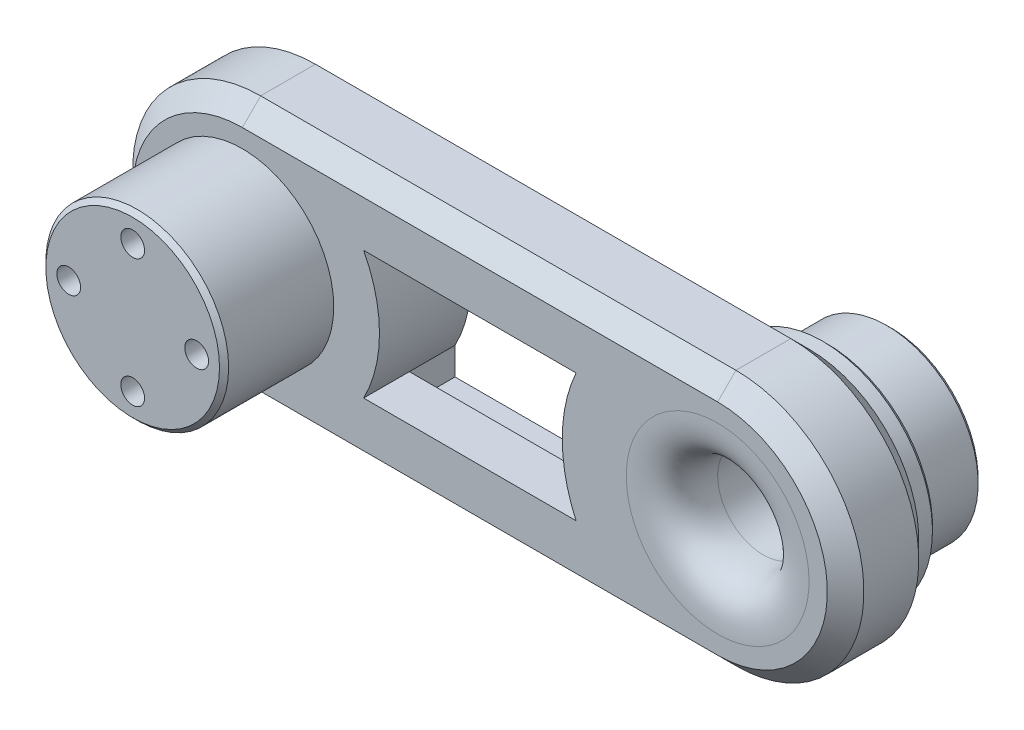
from build123d import *

# Parameters (mm, degrees)
EXTRUDE_1_DEPTH     = 10
SKETCH_2_R          = 10
EXTRUDE_2_DEPTH     = 12
SKETCH_3_R          = 10
EXTRUDE_3_DEPTH     = 9
SKETCH_4_R          = 12
SKETCH_4_R_2        = 10
EXTRUDE_4_DEPTH     = 2
CHAMFER_1_SIZE      = 0.5
CHAMFER_2_SIZE      = 2
SKETCH_5_R          = 2
CUT_EXTRUDE_1_DEPTH = 6
SKETCH_6_R          = 1.3
CUT_EXTRUDE_2_DEPTH = 6
CUT_EXTRUDE_3_DEPTH = 10
SKETCH_8_W          = 23.241567454
SKETCH_8_H          = 3
CUT_EXTRUDE_4_DEPTH = 5
SKETCH_9_R          = 5
CUT_EXTRUDE_5_DEPTH = 10
SKETCH_10_R         = 5
CUT_EXTRUDE_6_DEPTH = 10
FILLET_1_SIZE       = 5


# Some blends are built 0.0001 mm under size
with BuildPart() as part:
    # 草图1 → 凸台-拉伸1 (new body)
    with BuildSketch(Plane.XY):
        with BuildLine():
            Line((52, 14), (0, 14))
            ThreePointArc((0, 14), (-14, 0), (0, -14))
            Line((0, -14), (52, -14))
            ThreePointArc((52, -14), (66, 0), (52, 14))
        make_face()
    extrude(amount=EXTRUDE_1_DEPTH)

    # 草图2 → 凸台-拉伸2 (add)
    with BuildSketch(Plane.XY.offset(10)):
        Circle(SKETCH_2_R)
    extrude(amount=EXTRUDE_2_DEPTH)

    # 草图3 → 凸台-拉伸3 (add)
    with BuildSketch(Plane(origin=(0, 0, 0), x_dir=(-1, 0, 0), z_dir=(0, 0, -1))):
        with Locations((-52, 0)):
            Circle(SKETCH_3_R)
    extrude(amount=EXTRUDE_3_DEPTH)

    # 草图4 → 凸台-拉伸4 (add)
    with BuildSketch(Plane(origin=(0, 0, 0), x_dir=(-1, 0, 0), z_dir=(0, 0, -1))):
        with Locations(Location((-52, 0, 0), (0, 0, 180))):
            Circle(SKETCH_4_R)
        with Locations((-52, 0)):
            Circle(SKETCH_4_R_2, mode=Mode.SUBTRACT)
    extrude(amount=EXTRUDE_4_DEPTH)

    # 倒角1
    chamfer_1_edges = [part.edges().sort_by_distance(p)[0] for p in [
        (-10, 0, 22),
        (62, 0, -9),
        (40, 0, -2),
    ]]
    chamfer(chamfer_1_edges, length=CHAMFER_1_SIZE)

    # 倒角2
    chamfer_2_edges = [part.edges().sort_by_distance(p)[0] for p in [
        (66, 0, 10),
        (26, 14, 10),
        (-14, 0, 10),
        (26, -14, 10),
        (-14, 0, 0),
        (26, 14, 0),
        (66, 0, 0),
        (26, -14, 0),
    ]]
    chamfer(chamfer_2_edges, length=CHAMFER_2_SIZE - 0.0001)  # a hair under: the kernel refuses the full size

    # 草图5 → 切除-拉伸1 (cut)
    with BuildSketch(Plane(origin=(0, 0, -9), x_dir=(-1, 0, 0), z_dir=(0, 0, -1))):
        with Locations((-52, 5)):
            Circle(SKETCH_5_R)
        with Locations((-47.669872981, -2.5)):
            Circle(SKETCH_5_R)
        with Locations((-56.330127019, -2.5)):
            Circle(SKETCH_5_R)
    extrude(amount=-CUT_EXTRUDE_1_DEPTH, mode=Mode.SUBTRACT)

    # 草图6 → 切除-拉伸2 (cut)
    with BuildSketch(Plane.XY.offset(22)):
        with Locations((0, 7)):
            Circle(SKETCH_6_R)
        with Locations((7, 0)):
            Circle(SKETCH_6_R)
        with Locations((0, -7)):
            Circle(SKETCH_6_R)
        with Locations((-7, 0)):
            Circle(SKETCH_6_R)
    extrude(amount=-CUT_EXTRUDE_2_DEPTH, mode=Mode.SUBTRACT)

    # 草图7 → 切除-拉伸3 (cut)
    with BuildSketch(Plane.XY.offset(10)):
        with BuildLine():
            ThreePointArc((36.508066615, -7), (35, 0), (36.508066615, 7))
            Line((36.508066615, 7), (13.266499161, 7))
            ThreePointArc((13.266499161, 7), (14.560176637, 3.605725487), (15, 0))
            ThreePointArc((15, 0), (14.560176637, -3.605725487), (13.266499161, -7))
            Line((13.266499161, -7), (36.508066615, -7))
        make_face()
    extrude(amount=-CUT_EXTRUDE_3_DEPTH, mode=Mode.SUBTRACT)

    # 草图8 → 切除-拉伸4 (cut)
    with BuildSketch(Plane(origin=(0, 0, 0), x_dir=(-1, 0, 0), z_dir=(0, 0, -1))):
        with Locations((-24.887282888, 8.5)):
            Rectangle(SKETCH_8_W, SKETCH_8_H)
        with Locations((-24.887282888, -8.5)):
            Rectangle(SKETCH_8_W, SKETCH_8_H)
    extrude(amount=-CUT_EXTRUDE_4_DEPTH, mode=Mode.SUBTRACT)

    # 草图9 → 切除-拉伸5 (cut)
    with BuildSketch(Plane.XY.offset(10)):
        with Locations((52, 0)):
            Circle(SKETCH_9_R)
    extrude(amount=-CUT_EXTRUDE_5_DEPTH, mode=Mode.SUBTRACT)

    # 草图10 → 切除-拉伸6 (cut)
    with BuildSketch(Plane(origin=(0, 0, 0), x_dir=(-1, 0, 0), z_dir=(0, 0, -1))):
        Circle(SKETCH_10_R)
    extrude(amount=-CUT_EXTRUDE_6_DEPTH, mode=Mode.SUBTRACT)

    # 圆角1
    # a fillet whose section is not a circle: 5 mm, written as the material it takes off along each edge
    with BuildSketch(Plane(origin=(52, 0, 10), x_dir=(1, 0, 0), z_dir=(0, -1, 0))) as fillet_1_piece_1:
        with BuildLine():
            add(Edge.make_bspline([(5 + FILLET_1_SIZE, 0), (5 + FILLET_1_SIZE * 0.831801948466, 0), (5 + FILLET_1_SIZE * 0.663603896932, 0), (5 + FILLET_1_SIZE * 0.292893218813, -FILLET_1_SIZE * 0.0716919198361), (5 + FILLET_1_SIZE * 0.0716919198361, -FILLET_1_SIZE * 0.292893218813), (5, -FILLET_1_SIZE * 0.663603896932), (5, -FILLET_1_SIZE * 0.831801948466), (5, -FILLET_1_SIZE)], knots=[0, 0, 0, 0, 0, 0, 0.5, 0.5, 1, 1, 1, 1, 1, 1], degree=5))
            Line((5, -FILLET_1_SIZE), (5, 0))
            Line((5, 0), (5 + FILLET_1_SIZE, 0))
        make_face()
    revolve(axis=Axis((52, 0, 10), (0, 0, 1)), mode=Mode.SUBTRACT)
    with BuildSketch(Plane(origin=(0, 0, 0), x_dir=(-1, 0, 0), z_dir=(0, -1, 0))) as fillet_1_piece_2:
        with BuildLine():
            add(Edge.make_bspline([(5 + FILLET_1_SIZE, 0), (5 + FILLET_1_SIZE * 0.831801948466, 0), (5 + FILLET_1_SIZE * 0.663603896932, 0), (5 + FILLET_1_SIZE * 0.292893218813, -FILLET_1_SIZE * 0.0716919198361), (5 + FILLET_1_SIZE * 0.0716919198361, -FILLET_1_SIZE * 0.292893218813), (5, -FILLET_1_SIZE * 0.663603896932), (5, -FILLET_1_SIZE * 0.831801948466), (5, -FILLET_1_SIZE)], knots=[0, 0, 0, 0, 0, 0, 0.5, 0.5, 1, 1, 1, 1, 1, 1], degree=5))
            Line((5, -FILLET_1_SIZE), (5, 0))
            Line((5, 0), (5 + FILLET_1_SIZE, 0))
        make_face()
    revolve(axis=Axis((0, 0, 0), (0, 0, -1)), mode=Mode.SUBTRACT)


solid = part.part
